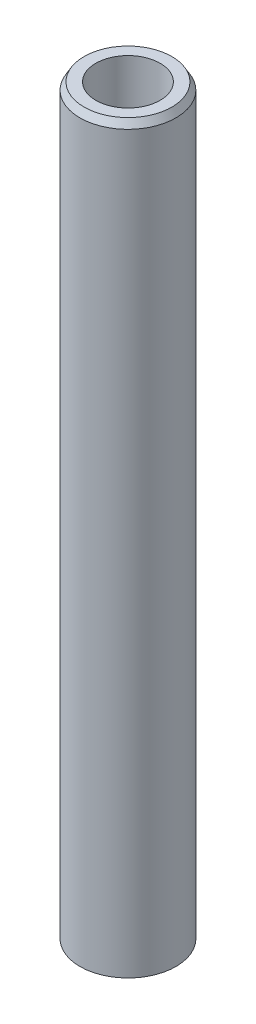
from build123d import *
from OCP.BRepFilletAPI import BRepFilletAPI_MakeChamfer

# Parameters (mm, degrees)
SKETCH1_R           = 10
BOSS_EXTRUDE1_DEPTH = 155.424492889
SKETCH2_R           = 6.69638004
CUT_EXTRUDE1_DEPTH  = 157.066565894
CHAMFER1_SIZE       = 1.503954657
CHAMFER1_SIZE2      = 0.868308626


with BuildPart() as part:
    # Sketch1 → Boss-Extrude1 (new body)
    with BuildSketch(Plane(origin=(0, 0, 0), x_dir=(1, 0, 0), z_dir=(0, 1, 0))):
        Circle(SKETCH1_R)
    extrude(amount=BOSS_EXTRUDE1_DEPTH)

    # Sketch2 → Cut-Extrude1 (cut, through all)
    with BuildSketch(Plane(origin=(0, 0, 0), x_dir=(1, 0, 0), z_dir=(0, 1, 0))):
        Circle(SKETCH2_R)
    extrude(amount=CUT_EXTRUDE1_DEPTH, mode=Mode.SUBTRACT)

    # Chamfer1: one chamfer whose edges measure the first distance from different faces: ONE call of the kernel's chamfer builder (chamfer() names one face for all edges)
    chamfer1_edges_1 = [part.edges().sort_by_distance(p)[0] for p in [
        (-10, 155.424492889, 0),
    ]]
    chamfer1_side_1 = [part.faces().sort_by_distance(p)[0] for p in [
        (-10, 77.712246445, 0),
    ]]
    chamfer1_edges_2 = [part.edges().sort_by_distance(p)[0] for p in [
        (-10, 0, 0),
    ]]
    chamfer1_side_2 = [part.faces().sort_by_distance(p)[0] for p in [
        (-9.717157288, 0, 0),
    ]]
    chamfer1 = BRepFilletAPI_MakeChamfer(part.part.solid().wrapped)
    for e in chamfer1_edges_1:
        chamfer1.Add(CHAMFER1_SIZE, CHAMFER1_SIZE2, e.wrapped, chamfer1_side_1[0].wrapped)  # the first distance lies on this face
    for e in chamfer1_edges_2:
        chamfer1.Add(CHAMFER1_SIZE, CHAMFER1_SIZE2, e.wrapped, chamfer1_side_2[0].wrapped)  # the first distance lies on this face
    add(Compound.cast(chamfer1.Shape()), mode=Mode.REPLACE)


solid = part.part
